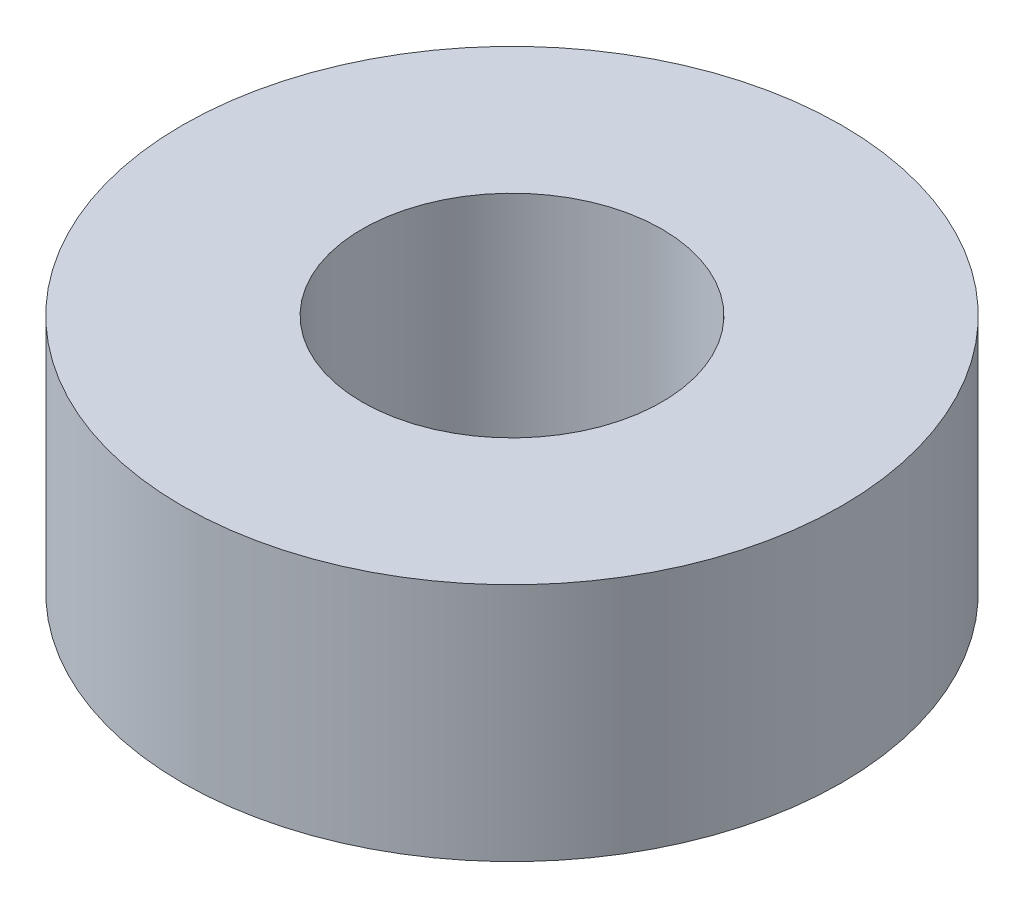
from build123d import *

# Parameters (mm, degrees)
BOSS_EXTRUDE1_DEPTH      = 2
BOSS_EXTRUDE1_DEPTH_BACK = 2
SKETCH1_R                = 5.5
SKETCH1_R_2              = 2.5


with BuildPart() as part:
    # Sketch1 → Boss-Extrude1 (new, two sides: drawn at the far end of the back side and taken through both)
    with BuildSketch(Plane(origin=(0, 0, 0), x_dir=(1, 0, 0), z_dir=(0, 1, 0)).offset(-BOSS_EXTRUDE1_DEPTH_BACK)):
        Circle(SKETCH1_R)
        Circle(SKETCH1_R_2, mode=Mode.SUBTRACT)
    extrude(amount=BOSS_EXTRUDE1_DEPTH + BOSS_EXTRUDE1_DEPTH_BACK)


solid = part.part
